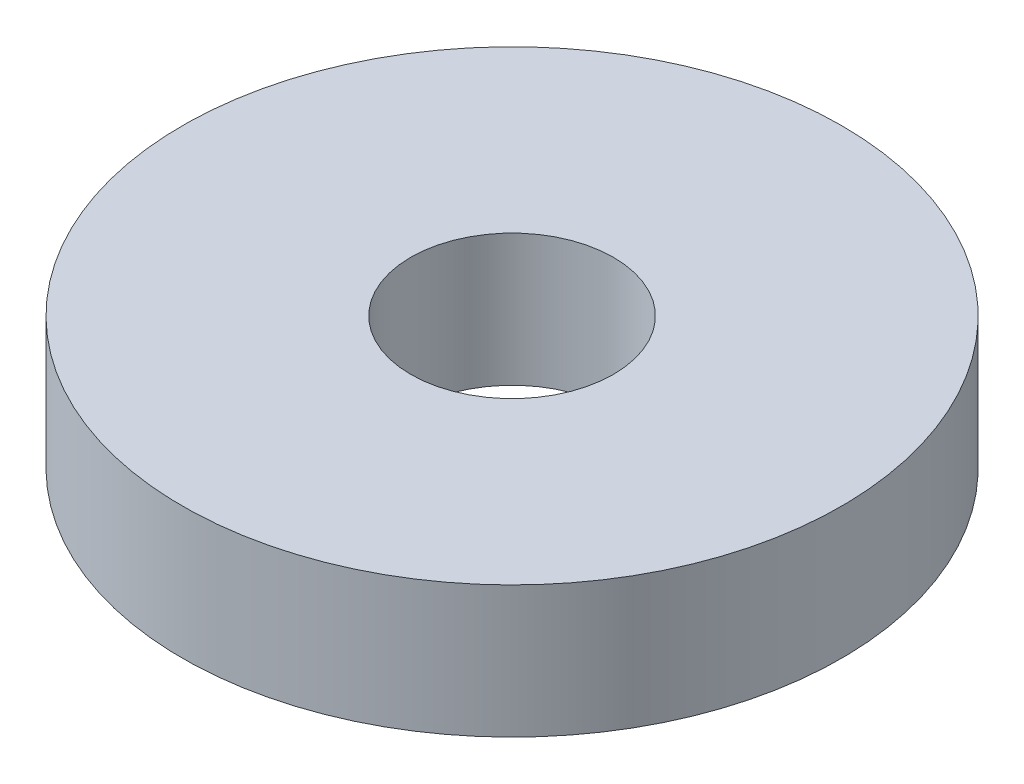
from build123d import *

# Parameters (mm, degrees)
SKETCH1_R           = 65
BOSS_EXTRUDE1_DEPTH = 26
SKETCH2_R           = 20
CUT_EXTRUDE1_DEPTH  = 96.530099969


with BuildPart() as part:
    # Sketch1 → Boss-Extrude1 (new body)
    with BuildSketch(Plane(origin=(0, 0, 0), x_dir=(1, 0, 0), z_dir=(0, 1, 0))):
        Circle(SKETCH1_R)
    extrude(amount=BOSS_EXTRUDE1_DEPTH)

    # Sketch2 → Cut-Extrude1 (cut, through all)
    with BuildSketch(Plane(origin=(0, 0, 0), x_dir=(1, 0, 0), z_dir=(0, 1, 0))):
        Circle(SKETCH2_R)
    extrude(amount=CUT_EXTRUDE1_DEPTH, mode=Mode.SUBTRACT)


solid = part.part
